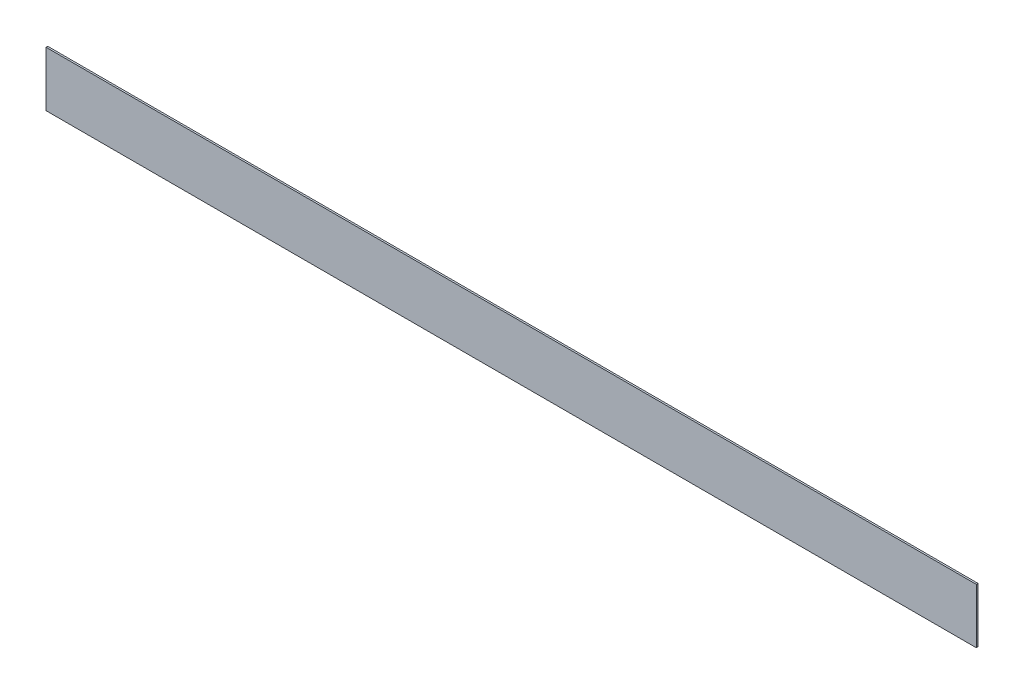
from build123d import *

# Parameters (mm, degrees)
SKETCH1_W           = 3.175
SKETCH1_H           = 101.6
BOSS_EXTRUDE1_DEPTH = 1720.85


with BuildPart() as part:
    # Sketch1 → Boss-Extrude1 (new body)
    with BuildSketch(Plane(origin=(0, 0, 0), x_dir=(0, 0, -1), z_dir=(1, 0, 0))):
        with Locations((-8.199010393, -17.076214186)):
            Rectangle(SKETCH1_W, SKETCH1_H)
    extrude(amount=BOSS_EXTRUDE1_DEPTH)


solid = part.part
